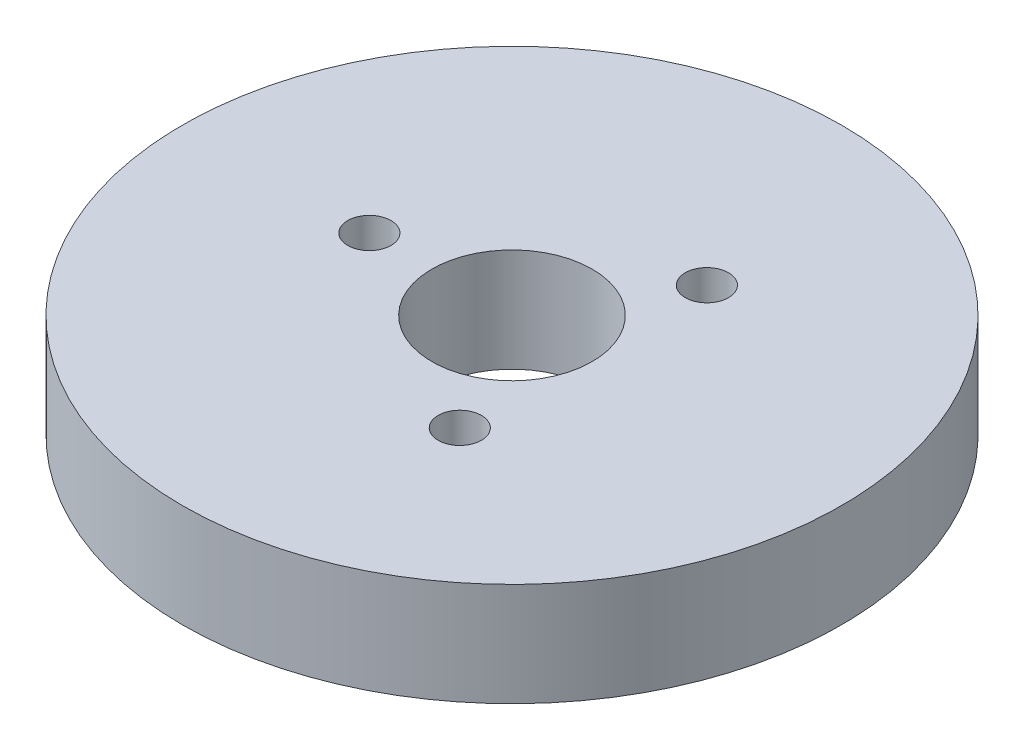
from build123d import *

# Parameters (mm, degrees)
SKETCH1_R           = 92.5
BOSS_EXTRUDE1_DEPTH = 29
SKETCH2_R           = 22.5
CUT_EXTRUDE1_DEPTH  = 134.990671317
SKETCH3_R           = 6.07092114
CUT_EXTRUDE2_DEPTH  = 19.543998966
CIRPATTERN1_COUNT   = 3


with BuildPart() as part:
    # Sketch1 → Boss-Extrude1 (new body)
    with BuildSketch(Plane(origin=(0, 0, 0), x_dir=(1, 0, 0), z_dir=(0, 1, 0))):
        Circle(SKETCH1_R)
    extrude(amount=BOSS_EXTRUDE1_DEPTH)

    # Sketch2 → Cut-Extrude1 (cut, through all)
    with BuildSketch(Plane(origin=(0, 0, 0), x_dir=(1, 0, 0), z_dir=(0, 1, 0))):
        Circle(SKETCH2_R)
    extrude(amount=CUT_EXTRUDE1_DEPTH, mode=Mode.SUBTRACT)

    # Sketch3 → Cut-Extrude2 (cut)
    with BuildSketch(Plane(origin=(0, 29, 0), x_dir=(1, 0, 0), z_dir=(0, 1, 0))):
        with Locations((-40.038820216, 0)):
            Circle(SKETCH3_R)
    cut_extrude2 = extrude(amount=-CUT_EXTRUDE2_DEPTH, mode=Mode.SUBTRACT)

    # CirPattern1: Cut-Extrude2 ×3 about axis
    cirpattern1_axis = Axis((0, 0, 0), (0, 1, 0))
    for i in range(1, CIRPATTERN1_COUNT):
        add(cut_extrude2.rotate(cirpattern1_axis, i * 360 / CIRPATTERN1_COUNT), mode=Mode.SUBTRACT)


solid = part.part
